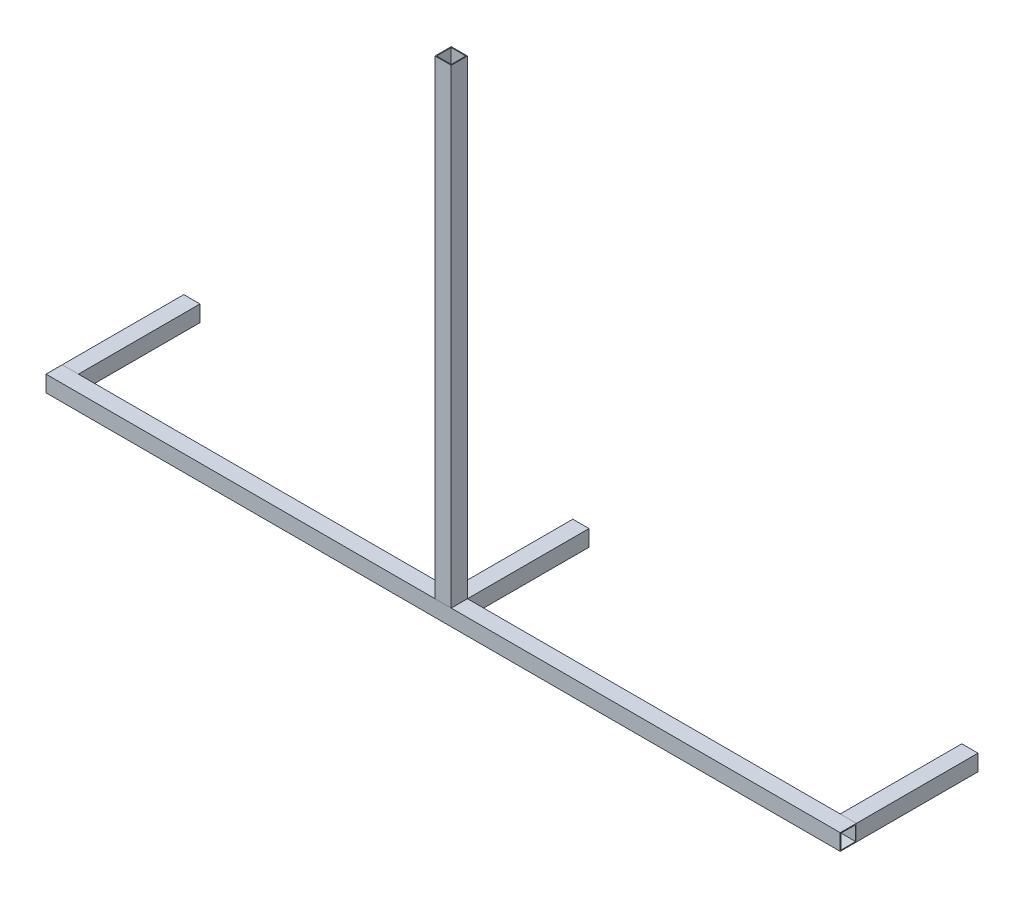
from build123d import *

# Parameters (mm, degrees)
CROQUIS1_W              = 20
CROQUIS1_H              = 20
CROQUIS1_W_2            = 18
CROQUIS1_H_2            = 18
EXTRUIR_L_MINA1_DEPTH   = 490
CROQUIS2_W              = 20
CROQUIS2_H              = 20
CROQUIS2_W_2            = 18
CROQUIS2_H_2            = 18
EXTRUIR_L_MINA3_DEPTH   = 150
CROQUIS3_W              = 20
CROQUIS3_H              = 20
CROQUIS3_W_2            = 18
CROQUIS3_H_2            = 18
EXTRUIR_L_MINA5_DEPTH   = 150
EXTRUIR_L_MINA5_2_DEPTH = 150
CROQUIS4_W              = 20
CROQUIS4_H              = 20
CROQUIS4_W_2            = 18
CROQUIS4_H_2            = 18
EXTRUIR_L_MINA6_DEPTH   = 580


with BuildPart() as part:
    # Croquis1 → Extruir-Lámina1 (new, symmetric)
    with BuildSketch(Plane(origin=(0, 0, 0), x_dir=(0, 0, -1), z_dir=(1, 0, 0))):
        Rectangle(CROQUIS1_W, CROQUIS1_H)
        Rectangle(CROQUIS1_W_2, CROQUIS1_H_2, mode=Mode.SUBTRACT)
    extrude(amount=EXTRUIR_L_MINA1_DEPTH, both=True)


with BuildPart() as body_2:
    # Croquis2 → Extruir-Lámina3 (new body)
    with BuildSketch(Plane(origin=(0, 0, -10), x_dir=(-1, 0, 0), z_dir=(0, 0, -1))):
        Rectangle(CROQUIS2_W, CROQUIS2_H)
        Rectangle(CROQUIS2_W_2, CROQUIS2_H_2, mode=Mode.SUBTRACT)
    extrude(amount=EXTRUIR_L_MINA3_DEPTH)


with BuildPart() as body_3:
    # Croquis3 → Extruir-Lámina5 (new body)
    with BuildSketch(Plane(origin=(0, 0, -10), x_dir=(-1, 0, 0), z_dir=(0, 0, -1))):
        with Locations((-480, 0)):
            Rectangle(CROQUIS3_W, CROQUIS3_H)
        with Locations((-480, 0)):
            Rectangle(CROQUIS3_W_2, CROQUIS3_H_2, mode=Mode.SUBTRACT)
    extrude(amount=EXTRUIR_L_MINA5_DEPTH)


with BuildPart() as body_4:
    # Croquis3 → Extruir-L_mina5 2 (new body)
    with BuildSketch(Plane(origin=(0, 0, -10), x_dir=(-1, 0, 0), z_dir=(0, 0, -1))):
        with Locations((480, 0)):
            Rectangle(CROQUIS3_W, CROQUIS3_H)
        with Locations((480, 0)):
            Rectangle(CROQUIS3_W_2, CROQUIS3_H_2, mode=Mode.SUBTRACT)
    extrude(amount=EXTRUIR_L_MINA5_2_DEPTH)


with BuildPart() as body_5:
    # Croquis4 → Extruir-Lámina6 (new body)
    with BuildSketch(Plane(origin=(0, 10, 0), x_dir=(1, 0, 0), z_dir=(0, 1, 0))):
        Rectangle(CROQUIS4_W, CROQUIS4_H)
        Rectangle(CROQUIS4_W_2, CROQUIS4_H_2, mode=Mode.SUBTRACT)
    extrude(amount=EXTRUIR_L_MINA6_DEPTH)


solid = Compound([part.part, body_2.part, body_3.part, body_4.part, body_5.part])
